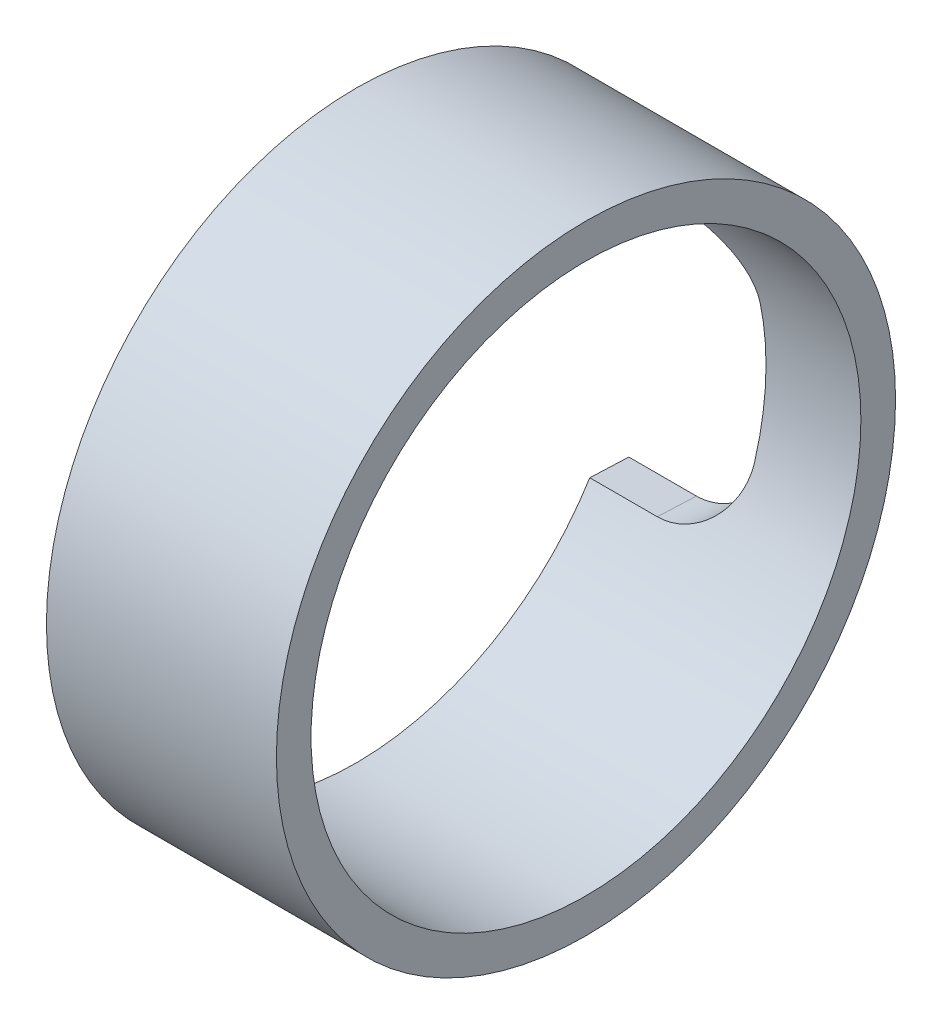
from build123d import *

# Parameters (mm, degrees)
SKETCH1_W          = 6.485999982
SKETCH1_H          = 0.977250014
CUT_EXTRUDE1_REACH = 49.014


with BuildPart() as part:
    # Sketch1 → Revolve1 (revolve)
    with BuildSketch(Plane.XY):
        with Locations((-42.119999961, 8.242624993)):
            Rectangle(SKETCH1_W, SKETCH1_H)
    revolve(axis=Axis((0, 0, 0), (-1, 0, 0)))

    # Sketch3 → Cut-Extrude1 (cut, up to next)
    with BuildSketch(Plane(origin=(0, 0, 0), x_dir=(1, 0, 0), z_dir=(0, -0.04069074645646237, -0.9991717886093543)), mode=Mode.PRIVATE) as cut_extrude1_sk1:
        with BuildLine():
            Line((-45.362999952, 3.81), (-45.362999952, -3.81))
            Line((-45.362999952, -3.81), (-43.457999952, -3.81))
            ThreePointArc((-43.457999952, -3.81), (-42.110961534, -3.252038418), (-41.552999952, -1.905))
            Line((-41.552999952, -1.905), (-41.552999952, 1.905))
            ThreePointArc((-41.552999952, 1.905), (-42.110961534, 3.252038418), (-43.457999952, 3.81))
            Line((-43.457999952, 3.81), (-45.362999952, 3.81))
        make_face()
    cut_extrude1_tool1 = extrude(cut_extrude1_sk1.sketch, amount=CUT_EXTRUDE1_REACH, mode=Mode.PRIVATE) & part.part
    add(cut_extrude1_tool1.solids().sort_by_distance((-43.541875, 0, 0))[0], mode=Mode.SUBTRACT)


solid = part.part
